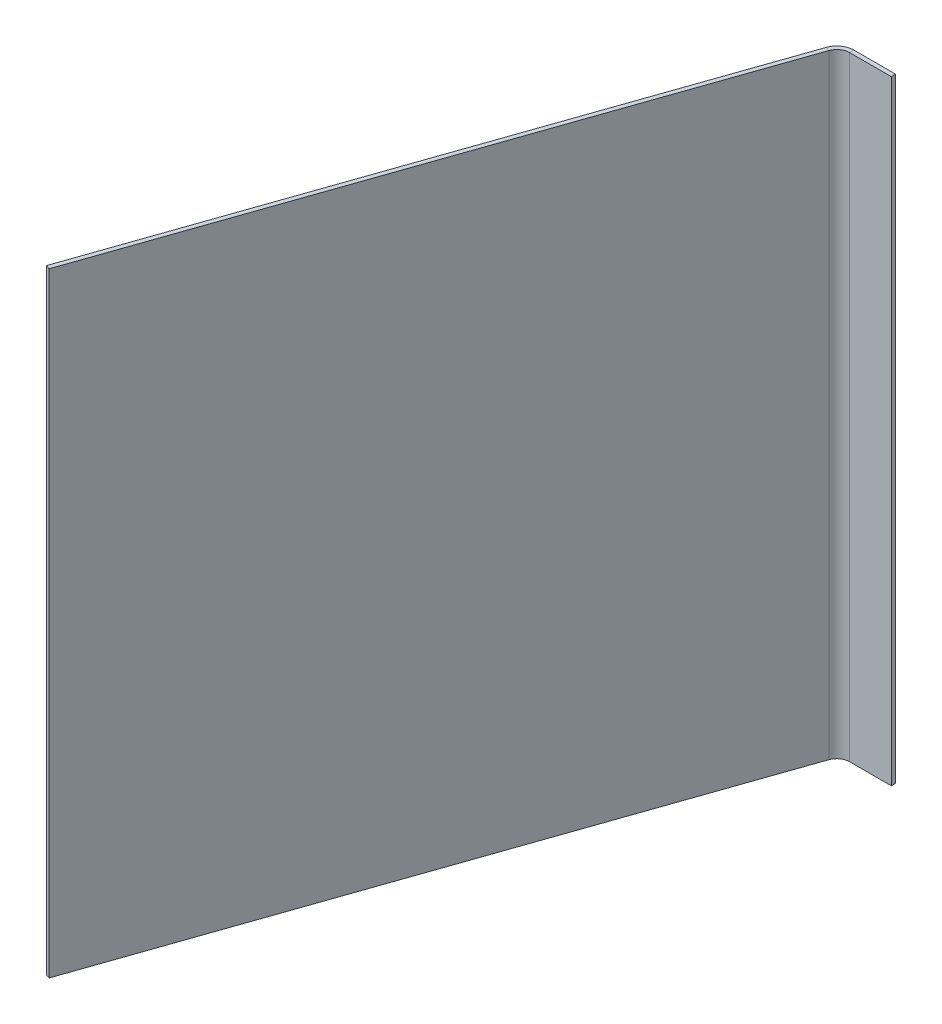
from build123d import *

# Parameters (mm, degrees)
BASE_FLANGE1_DEPTH = 285


# Sheet-metal steps are written as plain solids
with BuildPart() as part:
    # Sketch1 → Base-Flange1 (new body)
    with BuildSketch(Plane(origin=(0, 0, 0), x_dir=(1, 0, 0), z_dir=(0, 1, 0))):
        with BuildLine():
            Line((-54.734848485, -72.348484848), (38.475966015, 196.24583588))
            ThreePointArc((38.475966015, 196.24583588), (41.396047124, 200.141556223), (46.033800787, 201.62302564))
            Line((46.033800787, 201.62302564), (65.342022735, 201.62302564))
            Line((65.342022735, 201.62302564), (65.342022735, 199.62302564))
            Line((65.342022735, 199.62302564), (46.033800787, 199.62302564))
            ThreePointArc((46.033800787, 199.62302564), (42.555485539, 198.511923577), (40.365424708, 195.59013332))
            Line((40.365424708, 195.59013332), (-52.845389792, -73.004187409))
            Line((-52.845389792, -73.004187409), (-54.734848485, -72.348484848))
        make_face()
    extrude(amount=BASE_FLANGE1_DEPTH)


solid = part.part
